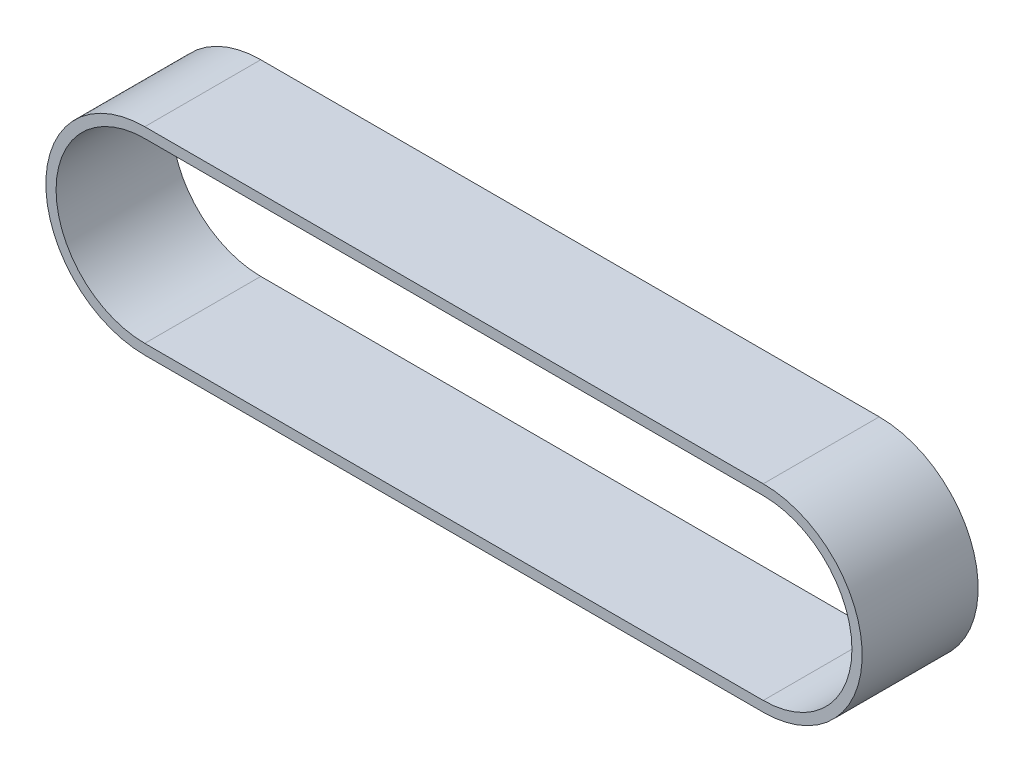
from build123d import *

# Parameters (mm, degrees)
BOSS_EXTRUDE1_DEPTH = 17


with BuildPart() as part:
    # Sketch1 → Boss-Extrude1 (new body)
    with BuildSketch(Plane.XY):
        with BuildLine():
            Line((-47.587155963, 12.711009174), (43.055045872, 12.711009174))
            ThreePointArc((43.055045872, 12.711009174), (57.555045872, -1.788990826), (43.055045872, -16.288990826))
            Line((43.055045872, -16.288990826), (-47.587155963, -16.288990826))
            ThreePointArc((-47.587155963, -16.288990826), (-62.087155963, -1.788990826), (-47.587155963, 12.711009174))
        make_face()
        with BuildLine():
            Line((-47.587155963, 11.211009174), (43.055045872, 11.211009174))
            ThreePointArc((43.055045872, 11.211009174), (56.055045872, -1.788990826), (43.055045872, -14.788990826))
            Line((43.055045872, -14.788990826), (-47.587155963, -14.788990826))
            ThreePointArc((-47.587155963, -14.788990826), (-60.587155963, -1.788990826), (-47.587155963, 11.211009174))
        make_face(mode=Mode.SUBTRACT)
    extrude(amount=BOSS_EXTRUDE1_DEPTH)


solid = part.part
